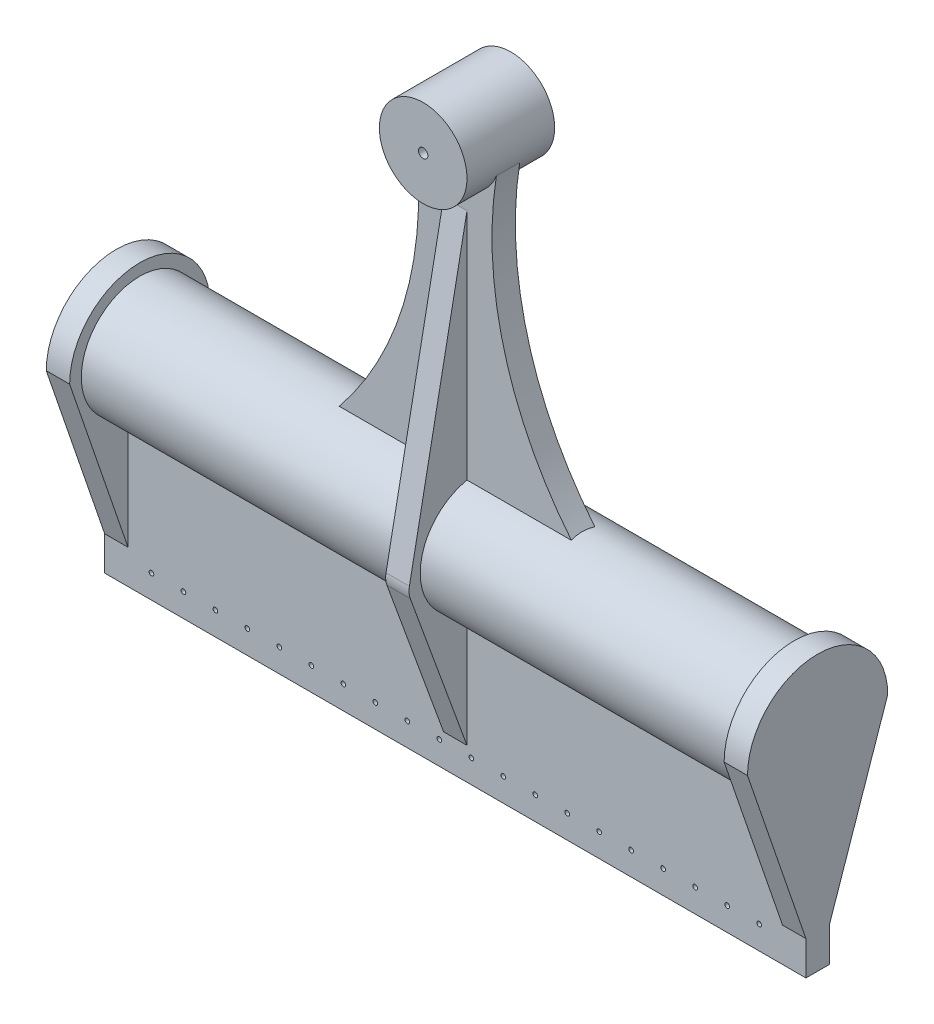
from build123d import *

# Parameters (mm, degrees)
BOSS_EXTRUDE1_DEPTH      = 2.54
BOSS_EXTRUDE1_DEPTH_BACK = 2.54
SKETCH1_W                = 44.45
SKETCH1_H                = 152.4
SKETCH1_R                = 0.508
BOSS_EXTRUDE2_DEPTH      = 76.2
BOSS_EXTRUDE2_DEPTH_BACK = 76.2
SKETCH2_R                = 12.7
BOSS_EXTRUDE3_START      = 71.12
BOSS_EXTRUDE3_DEPTH      = 5.08
BOSS_EXTRUDE4_START      = -76.2
BOSS_EXTRUDE4_DEPTH      = 5.08
BOSS_EXTRUDE5_DEPTH      = 2.54
BOSS_EXTRUDE5_DEPTH_BACK = 2.54
BOSS_EXTRUDE6_DEPTH      = 9.525
BOSS_EXTRUDE6_DEPTH_BACK = 9.525
SKETCH6_R                = 9.525
SKETCH6_R_2              = 1.016
BOSS_EXTRUDE7_DEPTH      = 2.54
BOSS_EXTRUDE7_DEPTH_BACK = 2.54


with BuildPart() as part:
    # Sketch1 → Boss-Extrude1 (new, two sides: drawn at the far end of the back side and taken through both)
    with BuildSketch(Plane(origin=(0, 0, 0), x_dir=(0, 1, 0), z_dir=(0, 0, 1)).offset(-BOSS_EXTRUDE1_DEPTH_BACK)):
        with Locations((-22.225, 0)):
            Rectangle(SKETCH1_W, SKETCH1_H)
        with Locations((-39.37, -66.04)):
            Circle(SKETCH1_R, mode=Mode.SUBTRACT)
        with Locations((-39.37, -59.088421053)):
            Circle(SKETCH1_R, mode=Mode.SUBTRACT)
        with Locations((-39.37, -52.136842105)):
            Circle(SKETCH1_R, mode=Mode.SUBTRACT)
        with Locations((-39.37, -45.185263158)):
            Circle(SKETCH1_R, mode=Mode.SUBTRACT)
        with Locations((-39.37, -38.233684211)):
            Circle(SKETCH1_R, mode=Mode.SUBTRACT)
        with Locations((-39.37, -31.282105263)):
            Circle(SKETCH1_R, mode=Mode.SUBTRACT)
        with Locations((-39.37, -24.330526316)):
            Circle(SKETCH1_R, mode=Mode.SUBTRACT)
        with Locations((-39.37, -17.378947368)):
            Circle(SKETCH1_R, mode=Mode.SUBTRACT)
        with Locations((-39.37, -10.427368421)):
            Circle(SKETCH1_R, mode=Mode.SUBTRACT)
        with Locations((-39.37, -3.475789474)):
            Circle(SKETCH1_R, mode=Mode.SUBTRACT)
        with Locations((-39.37, 3.475789474)):
            Circle(SKETCH1_R, mode=Mode.SUBTRACT)
        with Locations((-39.37, 10.427368421)):
            Circle(SKETCH1_R, mode=Mode.SUBTRACT)
        with Locations((-39.37, 17.378947368)):
            Circle(SKETCH1_R, mode=Mode.SUBTRACT)
        with Locations((-39.37, 24.330526316)):
            Circle(SKETCH1_R, mode=Mode.SUBTRACT)
        with Locations((-39.37, 31.282105263)):
            Circle(SKETCH1_R, mode=Mode.SUBTRACT)
        with Locations((-39.37, 38.233684211)):
            Circle(SKETCH1_R, mode=Mode.SUBTRACT)
        with Locations((-39.37, 45.185263158)):
            Circle(SKETCH1_R, mode=Mode.SUBTRACT)
        with Locations((-39.37, 52.136842105)):
            Circle(SKETCH1_R, mode=Mode.SUBTRACT)
        with Locations((-39.37, 59.088421053)):
            Circle(SKETCH1_R, mode=Mode.SUBTRACT)
        with Locations((-39.37, 66.04)):
            Circle(SKETCH1_R, mode=Mode.SUBTRACT)
    extrude(amount=BOSS_EXTRUDE1_DEPTH + BOSS_EXTRUDE1_DEPTH_BACK)

    # Sketch2 → Boss-Extrude2 (add, two sides: drawn at the far end of the back side and taken through both)
    with BuildSketch(Plane.YZ.offset(-BOSS_EXTRUDE2_DEPTH_BACK)):
        Circle(SKETCH2_R)
    extrude(amount=BOSS_EXTRUDE2_DEPTH + BOSS_EXTRUDE2_DEPTH_BACK)

    # Sketch3 → Boss-Extrude3 (add)
    with BuildSketch(Plane.YZ.offset(BOSS_EXTRUDE3_START)):
        with BuildLine():
            Line((0, 15.24), (-44.45, 0))
            Line((-44.45, 0), (0, -15.24))
            ThreePointArc((0, -15.24), (15.24, 0), (0, 15.24))
        make_face()
    extrude(amount=BOSS_EXTRUDE3_DEPTH)

    # Sketch4 → Boss-Extrude4 (add)
    with BuildSketch(Plane.YZ.offset(BOSS_EXTRUDE4_START)):
        with BuildLine():
            Line((0, 15.24), (-44.45, 0))
            Line((-44.45, 0), (0, -15.24))
            ThreePointArc((0, -15.24), (15.24, 0), (0, 15.24))
        make_face()
    extrude(amount=BOSS_EXTRUDE4_DEPTH)

    # Sketch5 → Boss-Extrude5 (add, two sides: drawn at the far end of the back side and taken through both)
    with BuildSketch(Plane(origin=(0, 0, 0), x_dir=(0, 1, 0), z_dir=(0, 0, 1)).offset(-BOSS_EXTRUDE5_DEPTH_BACK)):
        with BuildLine():
            Line((0, -38.1), (0, 38.1))
            ThreePointArc((0, 38.1), (33.985630195, 12.840847186), (76.2, 9.525))
            Line((76.2, 9.525), (76.2, -9.525))
            ThreePointArc((76.2, -9.525), (33.985630195, -12.840847186), (0, -38.1))
        make_face()
    extrude(amount=BOSS_EXTRUDE5_DEPTH + BOSS_EXTRUDE5_DEPTH_BACK)

    # Sketch6 → Boss-Extrude6 (add, two sides: drawn at the far end of the back side and taken through both)
    with BuildSketch(Plane(origin=(0, 0, 0), x_dir=(0, 1, 0), z_dir=(0, 0, 1)).offset(-BOSS_EXTRUDE6_DEPTH_BACK)):
        with Locations((76.2, 0)):
            Circle(SKETCH6_R)
        with Locations((76.2, 0)):
            Circle(SKETCH6_R_2, mode=Mode.SUBTRACT)
    extrude(amount=BOSS_EXTRUDE6_DEPTH + BOSS_EXTRUDE6_DEPTH_BACK)

    # Sketch7 → Boss-Extrude7 (add, two sides: drawn at the far end of the back side and taken through both)
    with BuildSketch(Plane.YZ.offset(-BOSS_EXTRUDE7_DEPTH_BACK)):
        with BuildLine():
            Line((-44.45, 0), (-3.723321906, 14.864400115))
            ThreePointArc((-3.723321906, 14.864400115), (-2.519507955, 15.126636864), (-1.289425019, 15.05712347))
            Line((-1.289425019, 15.05712347), (76.2, 0))
            Line((76.2, 0), (3.048089123, -14.93207128))
            ThreePointArc((3.048089123, -14.93207128), (-4.676176886, -15.336226713), (-12.178352745, -13.453413825))
            Line((-12.178352745, -13.453413825), (-44.45, 0))
        make_face()
    extrude(amount=BOSS_EXTRUDE7_DEPTH + BOSS_EXTRUDE7_DEPTH_BACK)


solid = part.part
